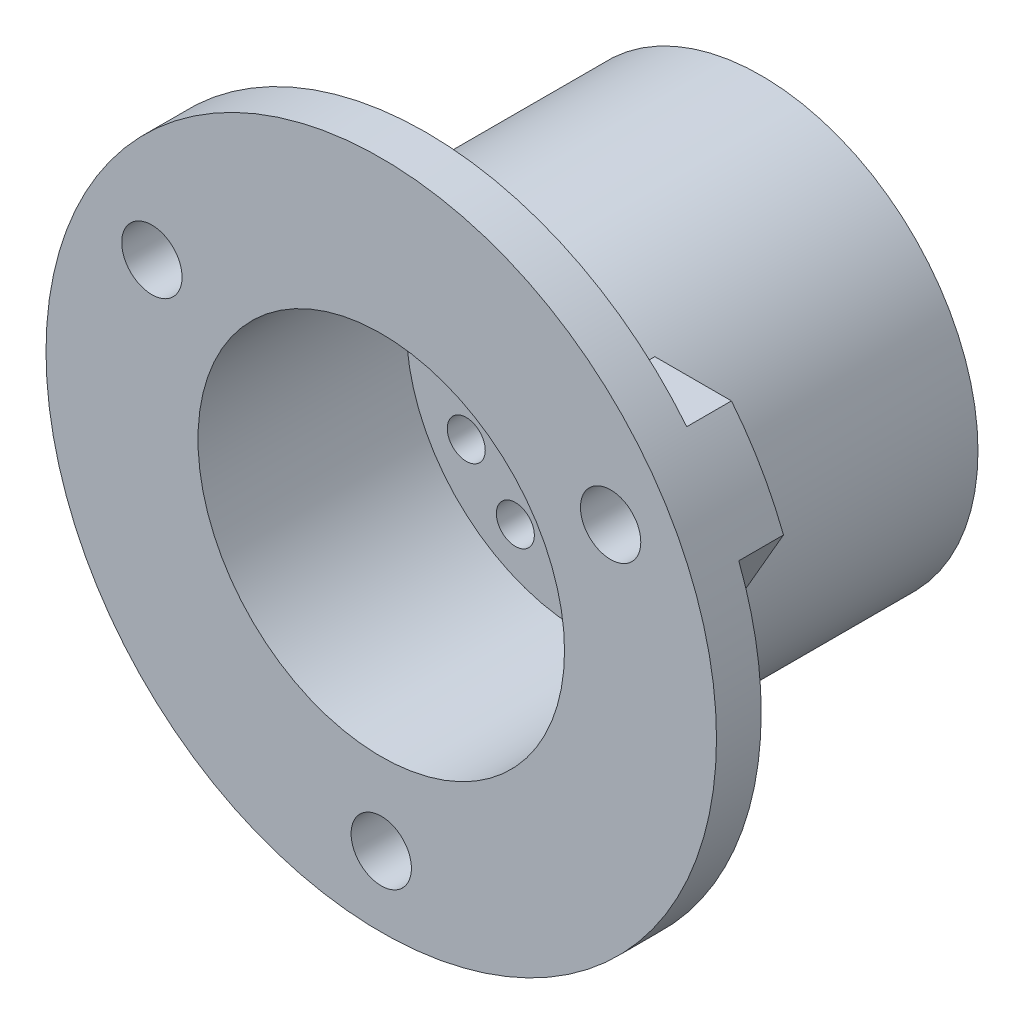
from build123d import *

# Parameters (mm, degrees)
SKETCH1_R                 = 7.875
SKETCH1_R_2               = 0.85
SKETCH1_R_3               = 1.25
BOSS_EXTRUDE1_DEPTH       = 5
EXTRUDE_THIN1_START       = -3
EXTRUDE_THIN1_OUTLINE_R   = 9.7
EXTRUDE_THIN1_OUTLINE_R_2 = 8.2
EXTRUDE_THIN1_DEPTH       = 17
SKETCH4_R                 = 15
SKETCH4_R_2               = 9.7
SKETCH4_R_3               = 1.35
BOSS_EXTRUDE2_DEPTH       = 2
BOSS_EXTRUDE3_START       = -2
BOSS_EXTRUDE3_DEPTH       = 2
CIRPATTERN1_COUNT         = 3
SKETCH4_5_R               = 1.35
CUT_EXTRUDE1_DEPTH        = 2


# Read off the part's stored shape, not the designer's step: Extrude-Thin1
with BuildPart() as part:
    # Sketch1 → Boss-Extrude1 (new body)
    with BuildSketch(Plane.XY):
        Circle(SKETCH1_R)
        with Locations((0, 6)):
            Circle(SKETCH1_R_2, mode=Mode.SUBTRACT)
        with Locations((3, 5.196152423)):
            Circle(SKETCH1_R_2, mode=Mode.SUBTRACT)
        with Locations((5.196152423, 3)):
            Circle(SKETCH1_R_2, mode=Mode.SUBTRACT)
        with Locations((6, 0)):
            Circle(SKETCH1_R_2, mode=Mode.SUBTRACT)
        with Locations((5.196152423, -3)):
            Circle(SKETCH1_R_2, mode=Mode.SUBTRACT)
        with Locations((3, -5.196152423)):
            Circle(SKETCH1_R_2, mode=Mode.SUBTRACT)
        with Locations((-3, -5.196152423)):
            Circle(SKETCH1_R_2, mode=Mode.SUBTRACT)
        with Locations((-5.196152423, -3)):
            Circle(SKETCH1_R_2, mode=Mode.SUBTRACT)
        with Locations((-6, 0)):
            Circle(SKETCH1_R_2, mode=Mode.SUBTRACT)
        with Locations((-5.196152423, 3)):
            Circle(SKETCH1_R_2, mode=Mode.SUBTRACT)
        with Locations((-3, 5.196152423)):
            Circle(SKETCH1_R_2, mode=Mode.SUBTRACT)
        with Locations((1.75, -2.4)):
            Circle(SKETCH1_R_2, mode=Mode.SUBTRACT)
        with Locations((-1.75, -2.4)):
            Circle(SKETCH1_R_2, mode=Mode.SUBTRACT)
        with Locations((0, 1.6)):
            Circle(SKETCH1_R_3, mode=Mode.SUBTRACT)
    extrude(amount=BOSS_EXTRUDE1_DEPTH)


with BuildPart() as body_2:
    # Extrude-Thin1 outline → Extrude-Thin1 (new body)
    with BuildSketch(Plane.XY.offset(EXTRUDE_THIN1_START)):
        Circle(EXTRUDE_THIN1_OUTLINE_R)
        Circle(EXTRUDE_THIN1_OUTLINE_R_2, mode=Mode.SUBTRACT)
    extrude(amount=EXTRUDE_THIN1_DEPTH)

    # Sketch4 → Boss-Extrude2 (add)
    with BuildSketch(Plane.XY.offset(14)):
        Circle(SKETCH4_R)
        Circle(SKETCH4_R_2, mode=Mode.SUBTRACT)
        with Locations((0, -11.85)):
            Circle(SKETCH4_R_3, mode=Mode.SUBTRACT)
    boss_extrude2 = extrude(amount=-BOSS_EXTRUDE2_DEPTH)

    # Sketch4<4> → Boss-Extrude3 (add)
    with BuildSketch(Plane.XY.offset(14).offset(BOSS_EXTRUDE3_START)):
        with BuildLine():
            Line((2.327707719, -14.818291966), (4.041451884, -11.85))
            Line((4.041451884, -11.85), (2.595880703, -9.346197268))
            ThreePointArc((2.595880703, -9.346197268), (0, -9.7), (-2.595880703, -9.346197268))
            Line((-2.595880703, -9.346197268), (-4.041451884, -11.85))
            Line((-4.041451884, -11.85), (-2.327707719, -14.818291966))
            ThreePointArc((-2.327707719, -14.818291966), (0, -15), (2.327707719, -14.818291966))
        make_face()
        Polygon((1.154700538, -9.85), (2.309401077, -11.85), (1.154700538, -13.85), (-1.154700538, -13.85), (-2.309401077, -11.85), (-1.154700538, -9.85), align=None, mode=Mode.SUBTRACT)
    boss_extrude3 = extrude(amount=-BOSS_EXTRUDE3_DEPTH)

    # CirPattern1: Boss-Extrude2, Boss-Extrude3 ×3 about axis
    cirpattern1_axis = Axis((0, 0, 0), (0, 0, 1))
    add([boss_extrude2.rotate(cirpattern1_axis, i * 360 / CIRPATTERN1_COUNT) for i in range(1, CIRPATTERN1_COUNT)])
    add([boss_extrude3.rotate(cirpattern1_axis, i * 360 / CIRPATTERN1_COUNT) for i in range(1, CIRPATTERN1_COUNT)])

    # Sketch4<5> → Cut-Extrude1 (cut)
    with BuildSketch(Plane.XY.offset(14)):
        with Locations((-10.262401035, 5.925)):
            Circle(SKETCH4_5_R)
        with Locations((10.262401035, 5.925)):
            Circle(SKETCH4_5_R)
        with Locations((0, -11.85)):
            Circle(SKETCH4_5_R)
    extrude(amount=-CUT_EXTRUDE1_DEPTH, mode=Mode.SUBTRACT)


solid = Compound([part.part, body_2.part])
